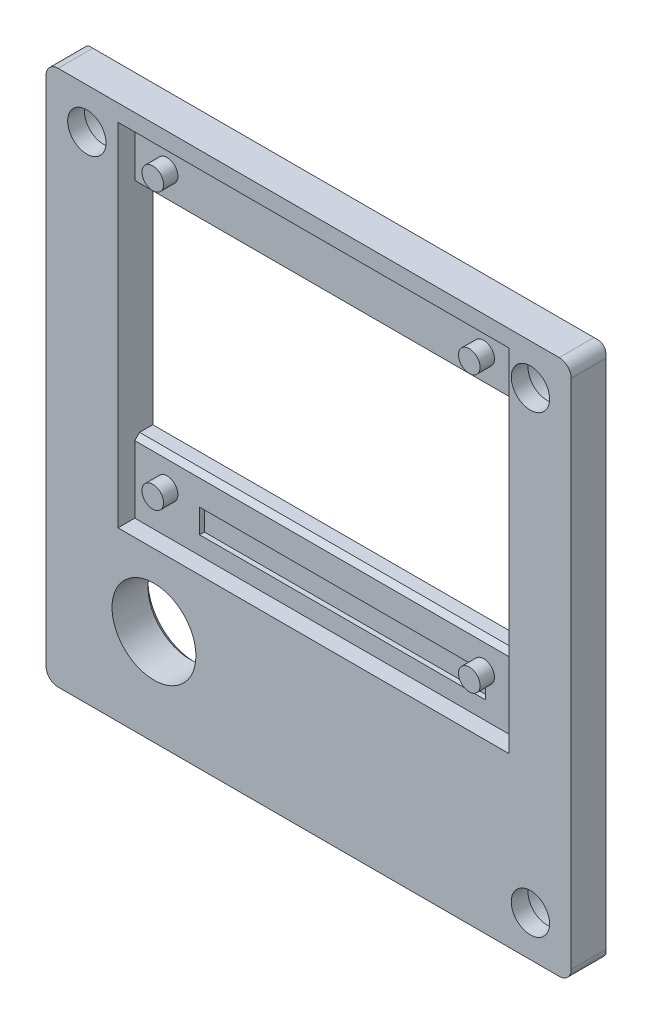
from build123d import *

# Parameters (mm, degrees)
EXTRUDE_1_DEPTH          = 2
SKETCH_17_W              = 31.8
SKETCH_17_H              = 18
CUT_EXTRUDE_1_DEPTH      = 10
CHAMFER_1_SIZE           = 0.5
CHAMFER_3_SIZE           = 0.5
SKETCH_25_W              = 23.840125732
SKETCH_25_H              = 2
CUT_EXTRUDE_5_DEPTH      = 0.4
CUT_EXTRUDE_6_DEPTH      = 6
CUT_EXTRUDE_6_DEPTH_BACK = 6
SKETCH_28_R              = 0.9
EXTRUDE_3_DEPTH          = 1.2
CHAMFER_6_SIZE           = 0.4
SKETCH_29_R              = 1.6
CUT_EXTRUDE_7_DEPTH      = 3.2
SKETCH_30_R              = 3.5
CUT_EXTRUDE_8_DEPTH      = 10
CHAMFER_9_SIZE           = 0.4
FILLET_1_R               = 1
SKETCH_31_R              = 2.55
CUT_EXTRUDE_9_DEPTH      = 2
CHAMFER_10_SIZE          = 0.4
SKETCH_32_R              = 3.5
SKETCH_32_R_2            = 1.6
SKETCH_32_W              = 32.6
SKETCH_32_H              = 29.3
EXTRUDE_5_DEPTH          = 1.4


with BuildPart() as part:
    # Эскиз1 → Бобышка-Вытянуть1 (new body)
    with BuildSketch(Plane.XY):
        Polygon((42.994929839, 15.7), (0.265604814, 15.7), (-0.805070161, 15.7), (-0.805070161, -3.225667373), (-0.805070161, -27.24226554), (-0.805070161, -29), (41.213218599, -29), (42.994929839, -29), (42.994929839, 0), align=None)
    extrude(amount=EXTRUDE_1_DEPTH)

    # Эскиз17 → Вырез-Вытянуть1 (cut)
    with BuildSketch(Plane(origin=(0, 0, 0), x_dir=(-1, 0, 0), z_dir=(0, 0, -1))):
        with Locations((-21.094929839, 0)):
            Rectangle(SKETCH_17_W, SKETCH_17_H)
    extrude(amount=-CUT_EXTRUDE_1_DEPTH, mode=Mode.SUBTRACT)

    # Фаска1
    chamfer_1_edges = [part.edges().sort_by_distance(p)[0] for p in [
        (36.994929839, 0, 0),
        (21.094929839, -9, 0),
        (5.194929839, 0, 0),
        (21.094929839, 9, 0),
    ]]
    chamfer(chamfer_1_edges, length=CHAMFER_1_SIZE)

    # Фаска3
    chamfer_3_edges = [part.edges().sort_by_distance(p)[0] for p in [
        (21.094929839, 15.7, 0),
        (42.994929839, -6.65, 0),
        (21.094929839, -29, 0),
        (-0.805070161, -6.65, 0),
    ]]
    chamfer(chamfer_3_edges, length=CHAMFER_3_SIZE)

    # Эскиз25 → Вырез-Вытянуть5 (cut)
    with BuildSketch(Plane.XY.offset(2)):
        with Locations((22.524068439, -12.5)):
            Rectangle(SKETCH_25_W, SKETCH_25_H)
    extrude(amount=-CUT_EXTRUDE_5_DEPTH, mode=Mode.SUBTRACT)

    # Эскиз27 → Вырез-Вытянуть6 (cut, two sides: drawn at the far end of the back side and taken through both)
    with BuildSketch(Plane(origin=(0, 0.1, 0), x_dir=(-1, 0, 0), z_dir=(0, -1, 0)).offset(-CUT_EXTRUDE_6_DEPTH_BACK)):
        Polygon((-36.994929839, -2), (-36.994929839, -1.2), (-37.794929839, -2), align=None)
    extrude(amount=CUT_EXTRUDE_6_DEPTH + CUT_EXTRUDE_6_DEPTH_BACK, mode=Mode.SUBTRACT)

    # Эскиз28 → Бобышка-Вытянуть3 (add)
    with BuildSketch(Plane.XY.offset(2)):
        with Locations((7.894929839, 11.5)):
            Circle(SKETCH_28_R)
        with Locations((34.294929839, 11.5)):
            Circle(SKETCH_28_R)
        with Locations(Location((34.294929839, -11.5, 0), (0, 0, 180))):
            Circle(SKETCH_28_R)
        with Locations((7.894929839, -11.5)):
            Circle(SKETCH_28_R)
    extrude(amount=EXTRUDE_3_DEPTH)

    # Фаска6
    chamfer_6_edges = [part.edges().sort_by_distance(p)[0] for p in [
        (21.094929839, 9, 2),
        (21.094929839, -9, 2),
    ]]
    chamfer(chamfer_6_edges, length=CHAMFER_6_SIZE)

    # Эскиз29 → Вырез-Вытянуть7 (cut)
    with BuildSketch(Plane.XY.offset(2)):
        with Locations((2.594929839, 12.3)):
            Circle(SKETCH_29_R)
        with Locations((39.594929839, 12.3)):
            Circle(SKETCH_29_R)
        with Locations((39.594929839, -25.6)):
            Circle(SKETCH_29_R)
    extrude(amount=-CUT_EXTRUDE_7_DEPTH, mode=Mode.SUBTRACT)

    # Эскиз30 → Вырез-Вытянуть8 (cut)
    with BuildSketch(Plane.XY.offset(2)):
        with Locations((8.194929839, -21)):
            Circle(SKETCH_30_R)
    extrude(amount=-CUT_EXTRUDE_8_DEPTH, mode=Mode.SUBTRACT)

    # Фаска9
    chamfer_9_edges = [part.edges().sort_by_distance(p)[0] for p in [
        (4.694929839, -21, 0),
    ]]
    chamfer(chamfer_9_edges, length=CHAMFER_9_SIZE)

    # Скругление1
    # the kernel refuses this fillet: 1 mm, written as the material it takes off along each edge
    with BuildSketch(Plane(origin=(42.994929839, -29, -2), x_dir=(0, 1, 0), z_dir=(0, 0, 1)), Plane(origin=(42.994929839, 15.7, -2), x_dir=(-1, 0, 0), z_dir=(0, 0, 1))) as fillet_1_piece_1:
        with BuildLine():
            CenterArc((FILLET_1_R, FILLET_1_R), FILLET_1_R, 180, 90)
            Line((0, FILLET_1_R), (0, 0))
            Line((0, 0), (FILLET_1_R, 0))
        make_face()
    extrude(amount=6.5, mode=Mode.SUBTRACT)
    with BuildSketch(Plane(origin=(-0.805070161, -29, -2), x_dir=(0, 1, 0), z_dir=(0, 0, 1)), Plane(origin=(-0.805070161, 15.7, -2), x_dir=(1, 0, 0), z_dir=(0, 0, 1))) as fillet_1_piece_2:
        with BuildLine():
            CenterArc((FILLET_1_R, -FILLET_1_R), FILLET_1_R, 90, 90)
            Line((0, -FILLET_1_R), (0, 0))
            Line((0, 0), (FILLET_1_R, 0))
        make_face()
    extrude(amount=6.5, mode=Mode.SUBTRACT)
    with BuildSketch(Plane(origin=(0.528263172, 14.366666667, -0.833333333), x_dir=(0.816496580927726, 0.4082482904638629, 0.4082482904638631), z_dir=(-0.5773502691896258, 0.5773502691896258, 0.5773502691896258)), Plane(origin=(0.528263172, -27.666666667, -0.833333333), x_dir=(-0.4082482904638631, 0.8164965809277261, 0.4082482904638631), z_dir=(-0.5773502691896258, -0.5773502691896258, 0.5773502691896258))) as fillet_1_piece_3:
        with BuildLine():
            CenterArc((FILLET_1_R * 0.57735026919, -FILLET_1_R), FILLET_1_R, 90, 60)
            Line((-FILLET_1_R * 0.288675134595, -FILLET_1_R * 0.5), (0, 0))
            Line((0, 0), (FILLET_1_R * 0.57735026919, 0))
        make_face()
    extrude(amount=3.75277675, mode=Mode.SUBTRACT)
    with BuildSketch(Plane(origin=(41.661596505, 14.366666667, -0.833333333), x_dir=(-0.8164965809277261, 0.4082482904638622, 0.4082482904638635), z_dir=(0.5773502691896256, 0.577350269189626, 0.577350269189626)), Plane(origin=(41.661596505, -27.666666667, -0.833333333), x_dir=(0.4082482904638636, 0.8164965809277261, 0.40824829046386224), z_dir=(0.5773502691896261, -0.5773502691896256, 0.5773502691896256))) as fillet_1_piece_4:
        with BuildLine():
            CenterArc((FILLET_1_R * 0.57735026919, FILLET_1_R), FILLET_1_R, 210, 60)
            Line((-FILLET_1_R * 0.288675134595, FILLET_1_R * 0.5), (0, 0))
            Line((0, 0), (FILLET_1_R * 0.57735026919, 0))
        make_face()
    extrude(amount=3.75277675, mode=Mode.SUBTRACT)

    # Эскиз31 → Вырез-Вытянуть9 (cut)
    with BuildSketch(Plane(origin=(0, 0, 0), x_dir=(-1, 0, 0), z_dir=(0, 0, -1))):
        with Locations((-39.594929839, 12.3)):
            Circle(SKETCH_31_R)
        with Locations((-2.594929839, 12.3)):
            Circle(SKETCH_31_R)
        with Locations((-39.594929839, -25.6)):
            Circle(SKETCH_31_R)
    extrude(amount=-CUT_EXTRUDE_9_DEPTH, mode=Mode.SUBTRACT)

    # Фаска10
    # the kernel refuses this chamfer: 0.4 mm, written as the material it takes off along each edge
    with BuildSketch(Plane(origin=(39.594929839, -25.6, 0), x_dir=(-1, 0, 0), z_dir=(0, -1, 0))) as chamfer_10_piece_1:
        Polygon((2.55 + CHAMFER_10_SIZE, 0), (2.55, -CHAMFER_10_SIZE), (2.55, 0), align=None)
    revolve(axis=Axis((39.594929839, -25.6, 0), (0, 0, -1)), mode=Mode.SUBTRACT)
    with BuildSketch(Plane(origin=(2.594929839, 12.3, 0), x_dir=(-1, 0, 0), z_dir=(0, -1, 0))) as chamfer_10_piece_2:
        Polygon((2.55 + CHAMFER_10_SIZE, 0), (2.55, -CHAMFER_10_SIZE), (2.55, 0), align=None)
    revolve(axis=Axis((2.594929839, 12.3, 0), (0, 0, -1)), mode=Mode.SUBTRACT)
    with BuildSketch(Plane(origin=(39.594929839, 12.3, 0), x_dir=(-1, 0, 0), z_dir=(0, -1, 0))) as chamfer_10_piece_3:
        Polygon((2.55 + CHAMFER_10_SIZE, 0), (2.55, -CHAMFER_10_SIZE), (2.55, 0), align=None)
    revolve(axis=Axis((39.594929839, 12.3, 0), (0, 0, -1)), mode=Mode.SUBTRACT)

    # Эскиз32 → Бобышка-Вытянуть5 (add)
    with BuildSketch(Plane.XY.offset(2)):
        with BuildLine():
            Line((-0.805070161, 14.7), (-0.805070161, -28))
            ThreePointArc((-0.805070161, -28), (-0.512176942, -28.707106781), (0.194929839, -29))
            Line((0.194929839, -29), (41.994929839, -29))
            ThreePointArc((41.994929839, -29), (42.70203662, -28.707106781), (42.994929839, -28))
            Line((42.994929839, -28), (42.994929839, 14.7))
            ThreePointArc((42.994929839, 14.7), (42.70203662, 15.407106781), (41.994929839, 15.7))
            Line((41.994929839, 15.7), (0.194929839, 15.7))
            ThreePointArc((0.194929839, 15.7), (-0.512176942, 15.407106781), (-0.805070161, 14.7))
        make_face()
        with Locations((8.194929839, -21)):
            Circle(SKETCH_32_R, mode=Mode.SUBTRACT)
        with Locations((39.594929839, -25.6)):
            Circle(SKETCH_32_R_2, mode=Mode.SUBTRACT)
        with Locations((39.594929839, 12.3)):
            Circle(SKETCH_32_R_2, mode=Mode.SUBTRACT)
        with Locations((2.594929839, 12.3)):
            Circle(SKETCH_32_R_2, mode=Mode.SUBTRACT)
        with Locations((21.494929839, -0.35)):
            Rectangle(SKETCH_32_W, SKETCH_32_H, mode=Mode.SUBTRACT)
    extrude(amount=EXTRUDE_5_DEPTH)


solid = part.part
